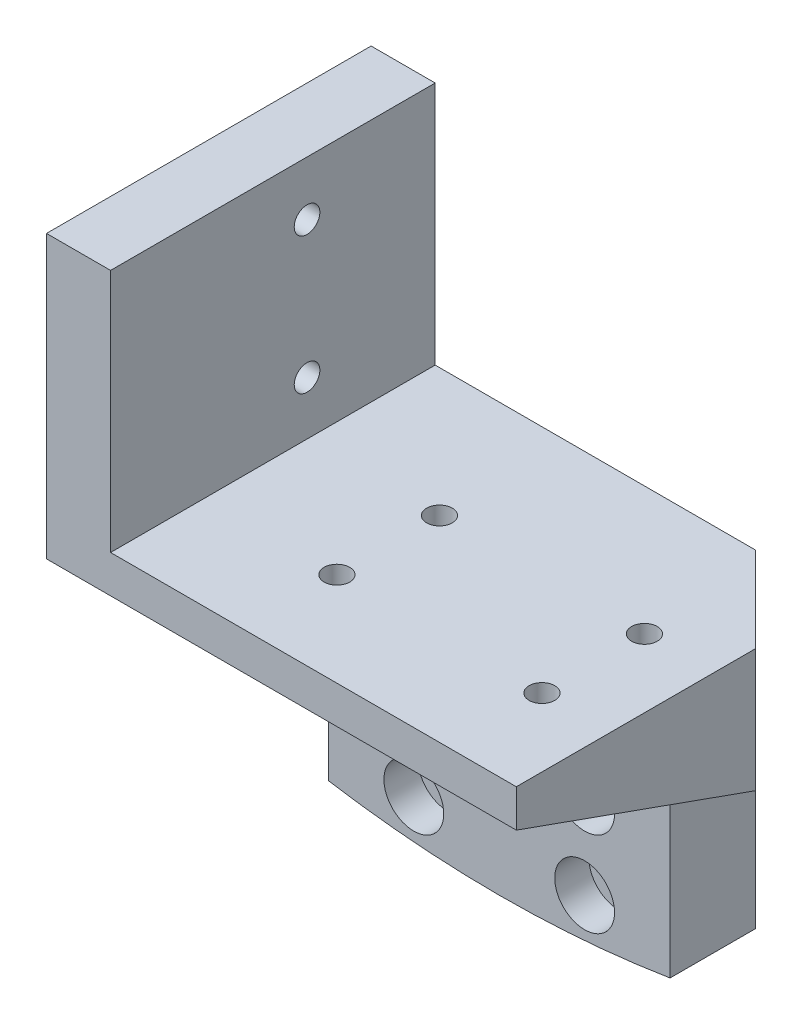
from build123d import *

# Parameters (mm, degrees)
BOSS_EXTRU_1_DEPTH      = 10
ENL_V_MAT_EXTRU_1_REACH = 128.984
ESQUISSE2_R             = 1.75
ESQUISSE4_R             = 3.5
ENL_V_MAT_EXTRU_2_DEPTH = 4
ESQUISSE5_W             = 50
ESQUISSE5_H             = 38
BOSS_EXTRU_2_DEPTH      = 14.4
ENL_V_MAT_EXTRU_3_REACH = 56.766
ESQUISSE6_R             = 1.5
ESQUISSE7_R             = 3
ENL_V_MAT_EXTRU_4_DEPTH = 9.4
CHANFREIN1_SIZE         = 10
CHANFREIN2_SIZE         = 28
CHANFREIN2_SIZE_2       = 10
BOSS_EXTRU_3_DEPTH      = 5
ESQUISSE9_W             = 38
ESQUISSE9_H             = 28.6
BOSS_EXTRU_4_DEPTH      = 2.5
CHANFREIN3_SIZE         = 5
ENL_V_MAT_EXTRU_5_REACH = 143.753
ESQUISSE10_R            = 1.5
ESQUISSE11_R            = 3
ENL_V_MAT_EXTRU_6_DEPTH = 2.5


# Some blends are built 0.0001 mm under size
with BuildPart() as part:
    # Esquisse1 → Boss.-Extru.1 (new body)
    with BuildSketch(Plane.XY):
        with BuildLine():
            Line((-20, -123.389626793), (-20, -99.4))
            Line((-20, -99.4), (20, -99.4))
            Line((20, -99.4), (20, -123.389626793))
            ThreePointArc((20, -123.389626793), (0, -125), (-20, -123.389626793))
        make_face()
    extrude(amount=BOSS_EXTRU_1_DEPTH)

    # Esquisse2 → Enlèv. mat.-Extru.1 (cut, up to next)
    with BuildSketch(Plane.XY.offset(10), mode=Mode.PRIVATE) as enl_v_mat_extru_1_sk1:
        with Locations((-10, -110)):
            Circle(ESQUISSE2_R)
    enl_v_mat_extru_1_tool1 = extrude(enl_v_mat_extru_1_sk1.sketch, amount=-ENL_V_MAT_EXTRU_1_REACH, mode=Mode.PRIVATE) & part.part
    # Esquisse2 → Enlèv. mat.-Extru.1 (cut, up to next)
    with BuildSketch(Plane.XY.offset(10), mode=Mode.PRIVATE) as enl_v_mat_extru_1_sk2:
        with Locations((-10, -120)):
            Circle(ESQUISSE2_R)
    enl_v_mat_extru_1_tool2 = extrude(enl_v_mat_extru_1_sk2.sketch, amount=-ENL_V_MAT_EXTRU_1_REACH, mode=Mode.PRIVATE) & part.part
    # Esquisse2 → Enlèv. mat.-Extru.1 (cut, up to next)
    with BuildSketch(Plane.XY.offset(10), mode=Mode.PRIVATE) as enl_v_mat_extru_1_sk3:
        with Locations((10, -110)):
            Circle(ESQUISSE2_R)
    enl_v_mat_extru_1_tool3 = extrude(enl_v_mat_extru_1_sk3.sketch, amount=-ENL_V_MAT_EXTRU_1_REACH, mode=Mode.PRIVATE) & part.part
    # Esquisse2 → Enlèv. mat.-Extru.1 (cut, up to next)
    with BuildSketch(Plane.XY.offset(10), mode=Mode.PRIVATE) as enl_v_mat_extru_1_sk4:
        with Locations((10, -120)):
            Circle(ESQUISSE2_R)
    enl_v_mat_extru_1_tool4 = extrude(enl_v_mat_extru_1_sk4.sketch, amount=-ENL_V_MAT_EXTRU_1_REACH, mode=Mode.PRIVATE) & part.part
    add(enl_v_mat_extru_1_tool1.solids().sort_by_distance((-10, -110, 10))[0], mode=Mode.SUBTRACT)
    add(enl_v_mat_extru_1_tool2.solids().sort_by_distance((-10, -120, 10))[0], mode=Mode.SUBTRACT)
    add(enl_v_mat_extru_1_tool3.solids().sort_by_distance((10, -110, 10))[0], mode=Mode.SUBTRACT)
    add(enl_v_mat_extru_1_tool4.solids().sort_by_distance((10, -120, 10))[0], mode=Mode.SUBTRACT)

    # Esquisse4 → Enlèv. mat.-Extru.2 (cut)
    with BuildSketch(Plane.XY.offset(10)):
        with Locations((-10, -110)):
            Circle(ESQUISSE4_R)
        with Locations((10, -110)):
            Circle(ESQUISSE4_R)
        with Locations((10, -120)):
            Circle(ESQUISSE4_R)
        with Locations((-10, -120)):
            Circle(ESQUISSE4_R)
    extrude(amount=-ENL_V_MAT_EXTRU_2_DEPTH, mode=Mode.SUBTRACT)

    # Esquisse5 → Boss.-Extru.2 (add)
    with BuildSketch(Plane(origin=(0, -99.4, 0), x_dir=(1, 0, 0), z_dir=(0, 1, 0))):
        with Locations((5, -19)):
            Rectangle(ESQUISSE5_W, ESQUISSE5_H)
    extrude(amount=BOSS_EXTRU_2_DEPTH)

    # Esquisse6 → Enlèv. mat.-Extru.3 (cut, up to next)
    with BuildSketch(Plane.XZ.offset(99.4), mode=Mode.PRIVATE) as enl_v_mat_extru_3_sk1:
        with Locations(Location((-2, 27, 0), (0, 0, 270))):
            Circle(ESQUISSE6_R)
    enl_v_mat_extru_3_tool1 = extrude(enl_v_mat_extru_3_sk1.sketch, amount=-ENL_V_MAT_EXTRU_3_REACH, mode=Mode.PRIVATE) & part.part
    # Esquisse6 → Enlèv. mat.-Extru.3 (cut, up to next)
    with BuildSketch(Plane.XZ.offset(99.4), mode=Mode.PRIVATE) as enl_v_mat_extru_3_sk2:
        with Locations(Location((22, 27, 0), (0, 0, 270))):
            Circle(ESQUISSE6_R)
    enl_v_mat_extru_3_tool2 = extrude(enl_v_mat_extru_3_sk2.sketch, amount=-ENL_V_MAT_EXTRU_3_REACH, mode=Mode.PRIVATE) & part.part
    # Esquisse6 → Enlèv. mat.-Extru.3 (cut, up to next)
    with BuildSketch(Plane.XZ.offset(99.4), mode=Mode.PRIVATE) as enl_v_mat_extru_3_sk3:
        with Locations(Location((-2, 15, 0), (0, 0, 270))):
            Circle(ESQUISSE6_R)
    enl_v_mat_extru_3_tool3 = extrude(enl_v_mat_extru_3_sk3.sketch, amount=-ENL_V_MAT_EXTRU_3_REACH, mode=Mode.PRIVATE) & part.part
    # Esquisse6 → Enlèv. mat.-Extru.3 (cut, up to next)
    with BuildSketch(Plane.XZ.offset(99.4), mode=Mode.PRIVATE) as enl_v_mat_extru_3_sk4:
        with Locations(Location((22, 15, 0), (0, 0, 270))):
            Circle(ESQUISSE6_R)
    enl_v_mat_extru_3_tool4 = extrude(enl_v_mat_extru_3_sk4.sketch, amount=-ENL_V_MAT_EXTRU_3_REACH, mode=Mode.PRIVATE) & part.part
    add(enl_v_mat_extru_3_tool1.solids().sort_by_distance((-2, -99.4, 27))[0], mode=Mode.SUBTRACT)
    add(enl_v_mat_extru_3_tool2.solids().sort_by_distance((22, -99.4, 27))[0], mode=Mode.SUBTRACT)
    add(enl_v_mat_extru_3_tool3.solids().sort_by_distance((-2, -99.4, 15))[0], mode=Mode.SUBTRACT)
    add(enl_v_mat_extru_3_tool4.solids().sort_by_distance((22, -99.4, 15))[0], mode=Mode.SUBTRACT)

    # Esquisse7 → Enlèv. mat.-Extru.4 (cut)
    with BuildSketch(Plane.XZ.offset(99.4)):
        with Locations(Location((-2, 27, 0), (0, 0, 270))):
            Circle(ESQUISSE7_R)
        with Locations(Location((22, 27, 0), (0, 0, 270))):
            Circle(ESQUISSE7_R)
        with Locations(Location((22, 15, 0), (0, 0, 270))):
            Circle(ESQUISSE7_R)
        with Locations(Location((-2, 15, 0), (0, 0, 270))):
            Circle(ESQUISSE7_R)
    extrude(amount=-ENL_V_MAT_EXTRU_4_DEPTH, mode=Mode.SUBTRACT)

    # Chanfrein1
    chanfrein1_edges = [part.edges().sort_by_distance(p)[0] for p in [
        (30, -92.2, 0),
    ]]
    chamfer(chanfrein1_edges, length=CHANFREIN1_SIZE)

    # Chanfrein2
    # the kernel refuses this chamfer: 28, 10 mm, written as the material it takes off along each edge
    with BuildSketch(Plane(origin=(102.642981969, -99.4, 38), x_dir=(0, -0.01296397650632004, -0.9999159641255577), z_dir=(-1, 0, 0))) as chanfrein2_piece_1:
        Polygon((CHANFREIN2_SIZE * 0.999915964126, -CHANFREIN2_SIZE * 0.0129639765063), (-CHANFREIN2_SIZE_2 * 0.0129639765063, -CHANFREIN2_SIZE_2 * 0.999915964126), (0, 0), align=None)
    extrude(amount=195.285963938, mode=Mode.SUBTRACT)

    # Esquisse8 → Boss.-Extru.3 (add)
    with BuildSketch(Plane.ZY.offset(20)):
        Polygon((10, -99.4), (0, -99.4), (0, -56.4), (38, -56.4), (38, -89.4), align=None)
    extrude(amount=BOSS_EXTRU_3_DEPTH)

    # Esquisse9 → Boss.-Extru.4 (add)
    with BuildSketch(Plane(origin=(-20, 0, 0), x_dir=(0, 0, -1), z_dir=(1, 0, 0))):
        with Locations((-19, -70.7)):
            Rectangle(ESQUISSE9_W, ESQUISSE9_H)
    extrude(amount=BOSS_EXTRU_4_DEPTH)

    # Chanfrein3
    chanfrein3_edges = [part.edges().sort_by_distance(p)[0] for p in [
        (-20, -99.4, 5),
    ]]
    chamfer(chanfrein3_edges, length=CHANFREIN3_SIZE - 0.0001)  # a hair under: the kernel refuses the full size

    # Esquisse10 → Enlèv. mat.-Extru.5 (cut, up to next)
    with BuildSketch(Plane.ZY.offset(25), mode=Mode.PRIVATE) as enl_v_mat_extru_5_sk1:
        with Locations(Location((15, -62.75, 0), (0, 0, 270))):
            Circle(ESQUISSE10_R)
    enl_v_mat_extru_5_tool1 = extrude(enl_v_mat_extru_5_sk1.sketch, amount=-ENL_V_MAT_EXTRU_5_REACH, mode=Mode.PRIVATE) & part.part
    # Esquisse10 → Enlèv. mat.-Extru.5 (cut, up to next)
    with BuildSketch(Plane.ZY.offset(25), mode=Mode.PRIVATE) as enl_v_mat_extru_5_sk2:
        with Locations(Location((15, -78.75, 0), (0, 0, 270))):
            Circle(ESQUISSE10_R)
    enl_v_mat_extru_5_tool2 = extrude(enl_v_mat_extru_5_sk2.sketch, amount=-ENL_V_MAT_EXTRU_5_REACH, mode=Mode.PRIVATE) & part.part
    add(enl_v_mat_extru_5_tool1.solids().sort_by_distance((-25, -62.75, 15))[0], mode=Mode.SUBTRACT)
    add(enl_v_mat_extru_5_tool2.solids().sort_by_distance((-25, -78.75, 15))[0], mode=Mode.SUBTRACT)

    # Esquisse11 → Enlèv. mat.-Extru.6 (cut)
    with BuildSketch(Plane.ZY.offset(25)):
        with Locations(Location((15, -62.75, 0), (0, 0, 270))):
            Circle(ESQUISSE11_R)
        with Locations(Location((15, -78.75, 0), (0, 0, 270))):
            Circle(ESQUISSE11_R)
    extrude(amount=-ENL_V_MAT_EXTRU_6_DEPTH, mode=Mode.SUBTRACT)


solid = part.part
